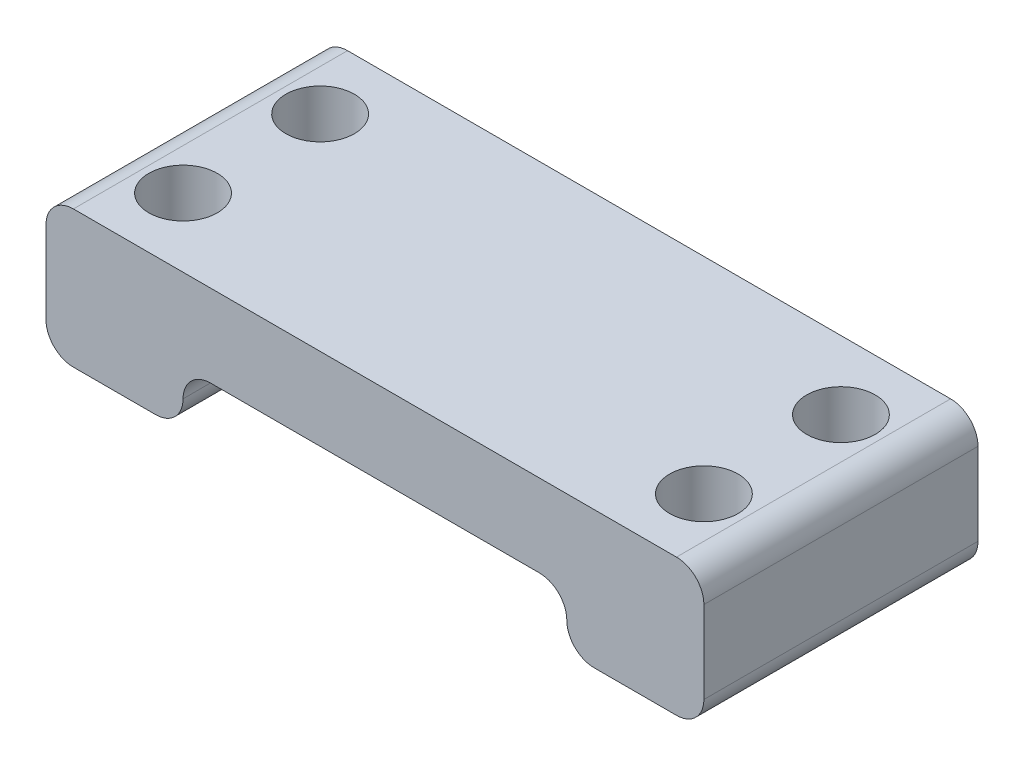
from build123d import *

# Parameters (mm, degrees)
SKETCH1_W           = 24
SKETCH1_H           = 10
BOSS_EXTRUDE1_DEPTH = 5
SKETCH2_W           = 14
SKETCH2_H           = 2
CUT_EXTRUDE1_DEPTH  = 17.401219467
FILLET1_R           = 1
SKETCH3_R           = 1.25
CUT_EXTRUDE2_DEPTH  = 14.928388277


with BuildPart() as part:
    # Sketch1 → Boss-Extrude1 (new body)
    with BuildSketch(Plane(origin=(0, 0, 0), x_dir=(1, 0, 0), z_dir=(0, 1, 0))):
        Rectangle(SKETCH1_W, SKETCH1_H)
    extrude(amount=BOSS_EXTRUDE1_DEPTH)

    # Sketch2 → Cut-Extrude1 (cut, through all)
    with BuildSketch(Plane.XY.offset(5)):
        with Locations((0, 1)):
            Rectangle(SKETCH2_W, SKETCH2_H)
    extrude(amount=-CUT_EXTRUDE1_DEPTH, mode=Mode.SUBTRACT)

    # Fillet1
    fillet1_edges = [part.edges().sort_by_distance(p)[0] for p in [
        (-12, 0, 0),
        (-12, 5, 0),
        (12, 5, 0),
        (12, 0, 0),
        (7, 0, 0),
        (7, 2, 0),
        (-7, 2, 0),
        (-7, 0, 0),
    ]]
    fillet(fillet1_edges, radius=FILLET1_R - 0.0001)  # a hair under: the kernel refuses the full size

    # Sketch3 → Cut-Extrude2 (cut, through all)
    with BuildSketch(Plane(origin=(0, 5, 0), x_dir=(1, 0, 0), z_dir=(0, 1, 0))):
        with Locations(Location((-9.5, 2.5, 0), (0, 0, 270))):
            Circle(SKETCH3_R)
        with Locations(Location((9.5, 2.5, 0), (0, 0, 270))):
            Circle(SKETCH3_R)
        with Locations(Location((-9.5, -2.5, 0), (0, 0, 270))):
            Circle(SKETCH3_R)
        with Locations(Location((9.5, -2.5, 0), (0, 0, 270))):
            Circle(SKETCH3_R)
    extrude(amount=-CUT_EXTRUDE2_DEPTH, mode=Mode.SUBTRACT)


solid = part.part
